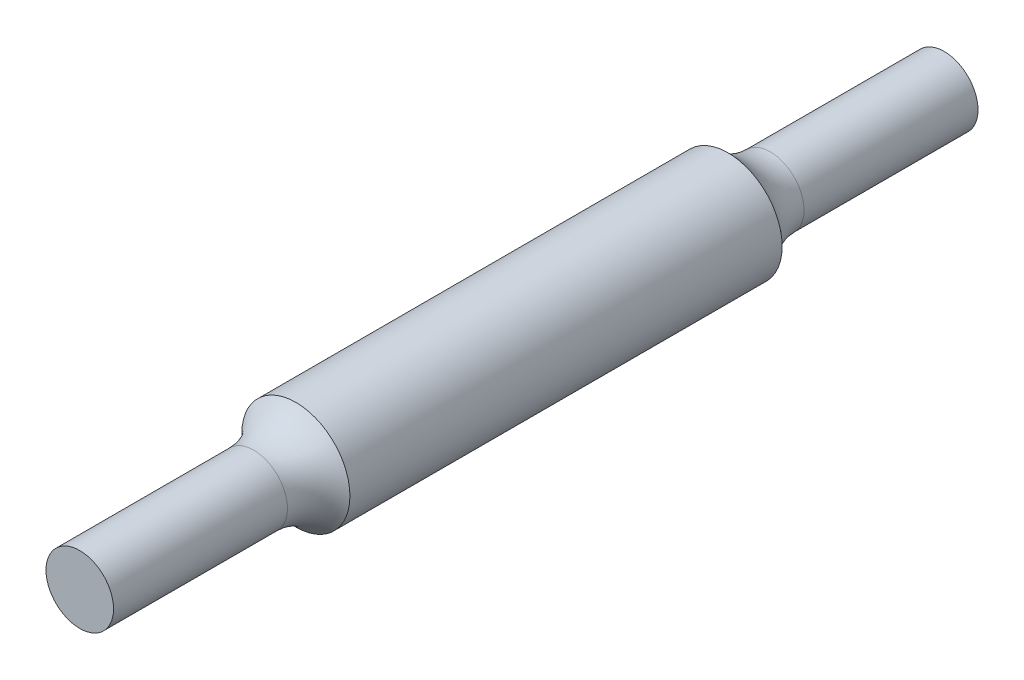
from build123d import *

# Parameters (mm, degrees)
SKETCH1_R           = 6.35
BOSS_EXTRUDE1_DEPTH = 25.4
SKETCH2_R           = 3.96875
BOSS_EXTRUDE2_DEPTH = 50.8
FILLET1_R           = 6.35


with BuildPart() as part:
    # Sketch1 → Boss-Extrude1 (new, symmetric)
    with BuildSketch(Plane.XY):
        Circle(SKETCH1_R)
    extrude(amount=BOSS_EXTRUDE1_DEPTH, both=True)

    # Sketch2 → Boss-Extrude2 (add, symmetric)
    with BuildSketch(Plane.XY):
        Circle(SKETCH2_R)
    extrude(amount=BOSS_EXTRUDE2_DEPTH, both=True)

    # Fillet1
    # the kernel refuses this fillet: 6.35 mm, written as the material it adds along each edge
    with BuildSketch(Plane(origin=(0, 0, -25.4), x_dir=(1, 0, 0), z_dir=(0, -1, 0))) as fillet1_piece_1:
        with BuildLine():
            CenterArc((10.31875, -4.956967161), FILLET1_R, 128.682187453, 51.317812547)
            Line((3.96875, -4.956967161), (3.84175, -4.956967161))
            Line((3.84175, -4.956967161), (3.84175, 0))
            Line((3.84175, 0), (3.96875, 0.127))
            ThreePointArc((3.96875, 0.127), (5.159375, 0.127), (6.270625, 0.099139343))
            Line((6.270625, 0.099139343), (6.35, 0))
        make_face()
    revolve(axis=Axis((0, 0, -25.4), (0, 0, 1)))
    with BuildSketch(Plane(origin=(0, 0, 25.4), x_dir=(1, 0, 0), z_dir=(0, -1, 0))) as fillet1_piece_2:
        with BuildLine():
            CenterArc((10.31875, 4.956967161), FILLET1_R, 180, 51.317812547)
            Line((3.96875, 4.956967161), (3.84175, 4.956967161))
            Line((3.84175, 4.956967161), (3.84175, 0))
            Line((3.84175, 0), (3.96875, -0.127))
            ThreePointArc((3.96875, -0.127), (5.159375, -0.127), (6.270625, -0.099139343))
            Line((6.270625, -0.099139343), (6.35, 0))
        make_face()
    revolve(axis=Axis((0, 0, 25.4), (0, 0, 1)))


solid = part.part
